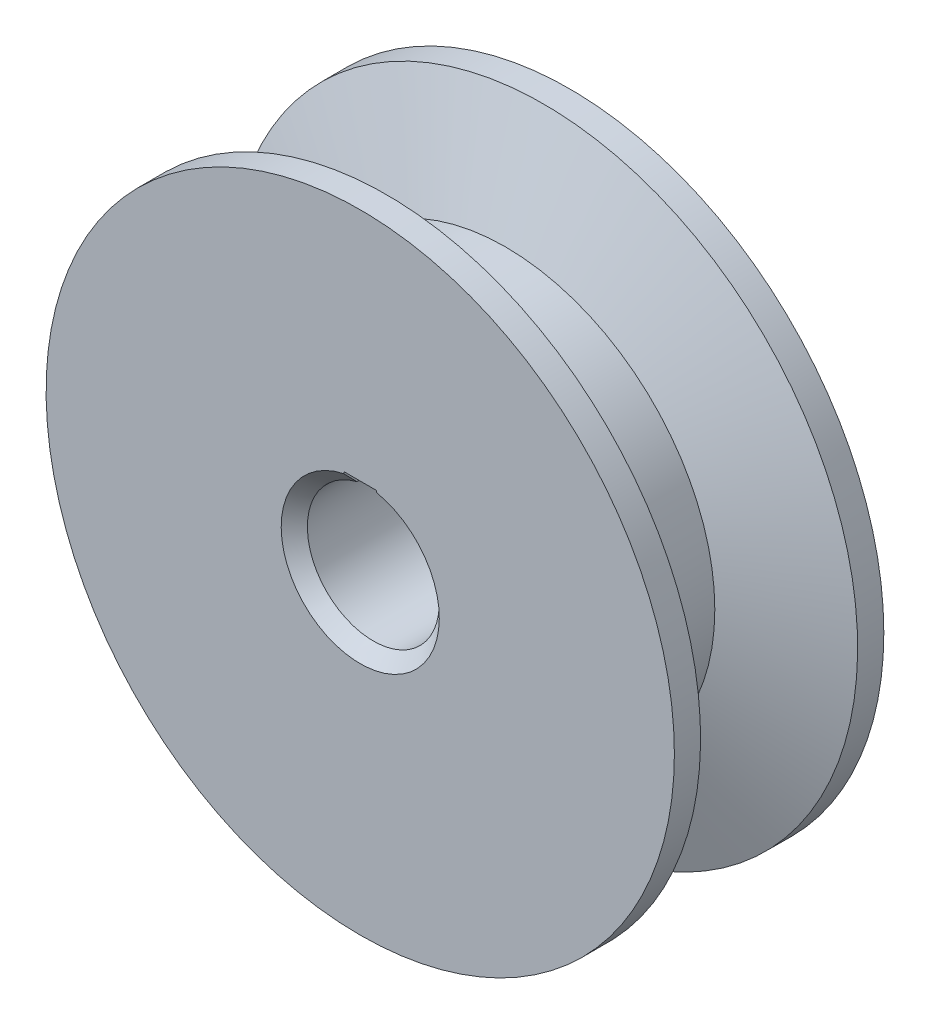
from build123d import *

# Parameters (mm, degrees)
SKETCH1_R          = 19.05
SKETCH1_R_2        = 4
EXTRUDE1_DEPTH     = 6.35
CHAMFER1_SIZE      = 0.79375
SKETCH3_W          = 2
SKETCH3_H          = 2
CUT_EXTRUDE1_DEPTH = 30.784140075


with BuildPart() as part:
    # Sketch1 → Extrude1 (new, symmetric)
    with BuildSketch(Plane.XY):
        Circle(SKETCH1_R)
        Circle(SKETCH1_R_2, mode=Mode.SUBTRACT)
    extrude(amount=EXTRUDE1_DEPTH, both=True)

    # Chamfer1
    chamfer1_edges = [part.edges().sort_by_distance(p)[0] for p in [
        (-4, 0, -6.35),
        (-4, 0, 6.35),
    ]]
    chamfer(chamfer1_edges, length=CHAMFER1_SIZE)

    # Sketch2 → Cut-Revolve1 (revolve, cut)
    with BuildSketch(Plane(origin=(0, 0, 0), x_dir=(0, 0, -1), z_dir=(1, 0, 0))):
        Polygon((-4.7625, 19.05), (4.7625, 19.05), (2.451289012, 12.7), (-2.451289012, 12.7), align=None)
    revolve(axis=Axis((0, 0, 6.35), (0, 0, -1)), mode=Mode.SUBTRACT)

    # Sketch3 → Cut-Extrude1 (cut, through all)
    with BuildSketch(Plane.XY.offset(6.35)):
        with Locations((0, 3.8)):
            Rectangle(SKETCH3_W, SKETCH3_H)
    extrude(amount=-CUT_EXTRUDE1_DEPTH, mode=Mode.SUBTRACT)


solid = part.part
